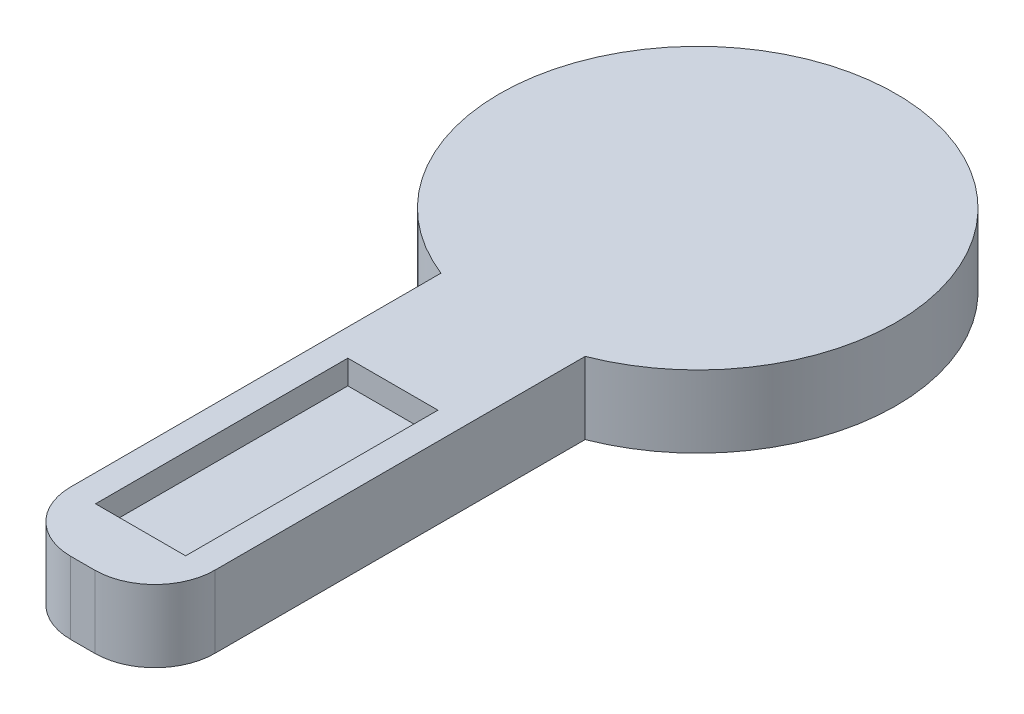
from build123d import *

# Parameters (mm, degrees)
SKETCH1_W           = 12
SKETCH1_H           = 60
BOSS_EXTRUDE1_DEPTH = 6
SKETCH2_W           = 7.5
SKETCH2_H           = 21
CUT_EXTRUDE1_DEPTH  = 2
SKETCH4_R           = 3.5
BOSS_EXTRUDE2_DEPTH = 1
SKETCH5_R           = 16.5
BOSS_EXTRUDE3_DEPTH = 6
FILLET2_R           = 5


with BuildPart() as part:
    # Sketch1 → Boss-Extrude1 (new body)
    with BuildSketch(Plane(origin=(0, 0, 0), x_dir=(1, 0, 0), z_dir=(0, 1, 0))):
        Rectangle(SKETCH1_W, SKETCH1_H)
    extrude(amount=BOSS_EXTRUDE1_DEPTH)

    # Sketch2 → Cut-Extrude1 (cut)
    with BuildSketch(Plane(origin=(0, 6, 0), x_dir=(1, 0, 0), z_dir=(0, 1, 0))):
        with Locations((0, -14.685)):
            Rectangle(SKETCH2_W, SKETCH2_H)
    extrude(amount=-CUT_EXTRUDE1_DEPTH, mode=Mode.SUBTRACT)

    # Sketch4 → Boss-Extrude2 (add)
    with BuildSketch(Plane.XZ):
        with Locations((0, 21.18)):
            Circle(SKETCH4_R)
    extrude(amount=BOSS_EXTRUDE2_DEPTH)

    # Sketch5 → Boss-Extrude3 (add)
    with BuildSketch(Plane(origin=(0, 6, 0), x_dir=(1, 0, 0), z_dir=(0, 1, 0))):
        with Locations((0, 21.19)):
            Circle(SKETCH5_R)
    extrude(amount=-BOSS_EXTRUDE3_DEPTH)

    # Fillet2
    fillet2_edges = [part.edges().sort_by_distance(p)[0] for p in [
        (6, 3, 30),
        (-6, 3, 30),
    ]]
    fillet(fillet2_edges, radius=FILLET2_R)


solid = part.part
